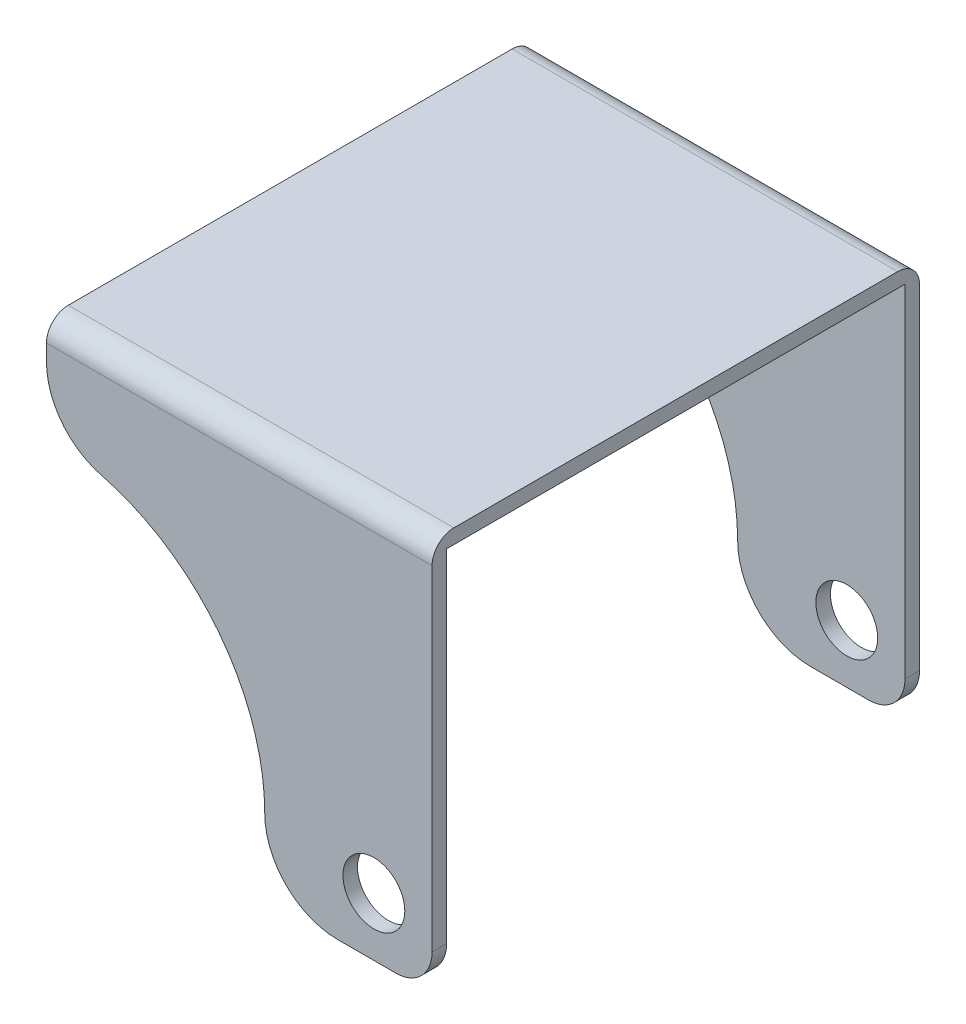
from build123d import *

# Parameters (mm, degrees)
BOSS_EXTRUDE1_DEPTH = 2
FILLET1_R           = 5
SKETCH2_R           = 4.25
CUT_EXTRUDE1_DEPTH  = 10
SKETCH3_W           = 53
SKETCH3_H           = 67
BOSS_EXTRUDE2_DEPTH = 2
FILLET2_R           = 3


with BuildPart() as part:
    # Sketch1 → Boss-Extrude1 (new body)
    with BuildSketch(Plane.XY):
        with BuildLine():
            Line((-27.5, 14.515231625), (-27.5, 17.785398163))
            Line((-27.5, 17.785398163), (25.5, 17.785398163))
            Line((25.5, 17.785398163), (25.5, -34.214601837))
            Line((25.5, -34.214601837), (12.5, -34.214601837))
            ThreePointArc((12.5, -34.214601837), (5.428932188, -31.285669648), (2.5, -24.214601837))
            ThreePointArc((2.5, -24.214601837), (-3.782917549, -5.843428766), (-20, 4.83277326))
            ThreePointArc((-20, 4.83277326), (-25.40569415, 8.391507269), (-27.5, 14.515231625))
        make_face()
    extrude(amount=BOSS_EXTRUDE1_DEPTH)

    # Fillet1
    fillet1_edges = [part.edges().sort_by_distance(p)[0] for p in [
        (25.5, -34.214601837, 1),
    ]]
    fillet(fillet1_edges, radius=FILLET1_R)

    # Sketch2 → Cut-Extrude1 (cut)
    with BuildSketch(Plane.XY.offset(2)):
        with Locations((17.5, -26.214601837)):
            Circle(SKETCH2_R)
    extrude(amount=-CUT_EXTRUDE1_DEPTH, mode=Mode.SUBTRACT)


with BuildPart() as body_2:
    # Mirror3: mirrored copy
    add(part.part.mirror(Plane(origin=(0, 0, -31.5), x_dir=(1, 0, 0), z_dir=(0, 0, -1))))


with BuildPart() as part_1:
    add(part.part)

    add(body_2.part)  # Boss-Extrude2 merges body 2
    # Sketch3 → Boss-Extrude2 (add)
    with BuildSketch(Plane(origin=(0, 17.785398163, 0), x_dir=(1, 0, 0), z_dir=(0, 1, 0))):
        with Locations((-1, 31.5)):
            Rectangle(SKETCH3_W, SKETCH3_H)
    extrude(amount=BOSS_EXTRUDE2_DEPTH)

    # Fillet2
    fillet2_edges = [part_1.edges().sort_by_distance(p)[0] for p in [
        (-1, 19.785398163, 2),
        (-1, 19.785398163, -65),
    ]]
    fillet(fillet2_edges, radius=FILLET2_R)


solid = part_1.part
